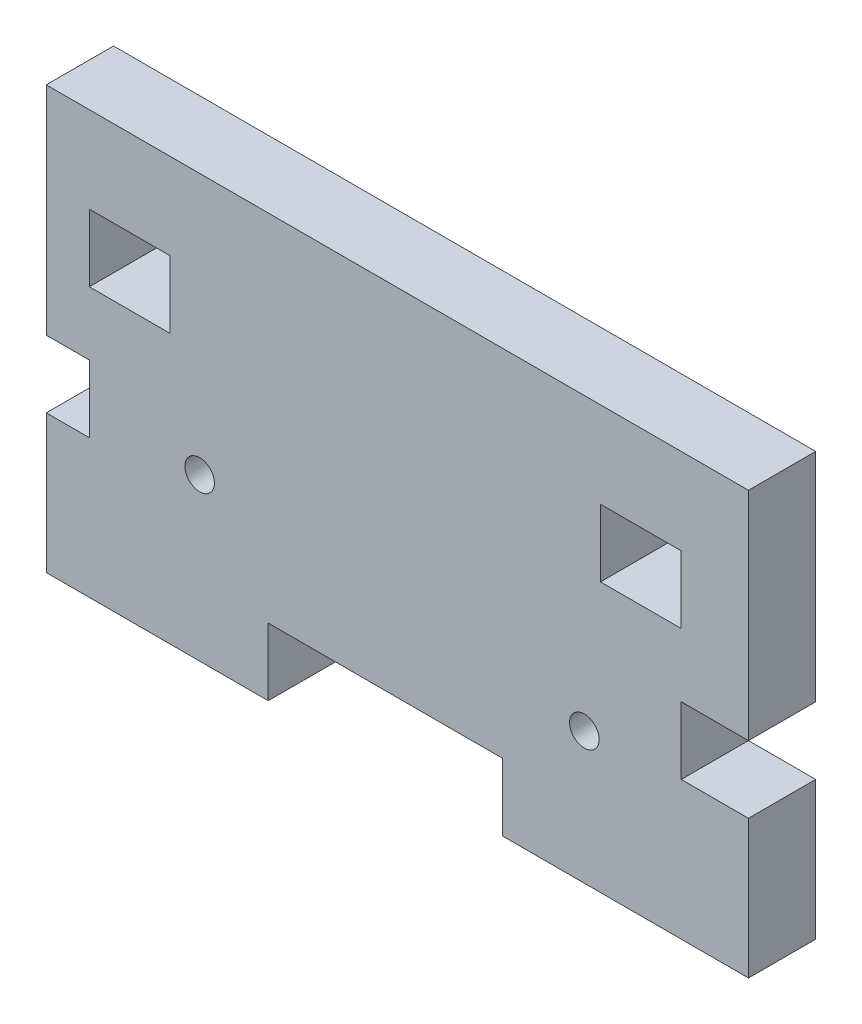
from build123d import *

# Parameters (mm, degrees)
SKETCH1_W             = 66.294
SKETCH1_H             = 39.878
BOSS_EXTRUDE1_DEPTH   = 3.175
CAVITY1_START         = -19.939
CAVITY1_OUTLINE_W     = 22.098
CAVITY1_OUTLINE_H     = 6.35
CAVITY1_DEPTH         = 6.35
CAVITY1_START_2       = 5.461
CAVITY1_2_OUTLINE_W   = 7.62
CAVITY1_2_OUTLINE_H   = 6.35
CAVITY1_2_DEPTH       = 6.35
CAVITY1_START_3       = -6.879912323
CAVITY1_3_OUTLINE_W   = 6.35
CAVITY1_3_OUTLINE_H   = 6.35
CAVITY1_3_OUTLINE_W_2 = 4.064
CAVITY1_3_DEPTH       = 6.35
SKETCH4_R             = 1.397
CUT_EXTRUDE1_DEPTH    = 40.199615177


# Read off the part's stored shape, not the designer's step: Cavity1
with BuildPart() as part:
    # Sketch1 → Boss-Extrude1 (new, symmetric)
    with BuildSketch(Plane.XY):
        Rectangle(SKETCH1_W, SKETCH1_H)
    extrude(amount=BOSS_EXTRUDE1_DEPTH, both=True)

    # Cavity1 outline → Cavity1 (cut)
    with BuildSketch(Plane(origin=(0, 0, 0), x_dir=(1, 0, 0), z_dir=(0, 1, 0)).offset(CAVITY1_START)):
        with Locations((-1.143, 0)):
            Rectangle(CAVITY1_OUTLINE_W, CAVITY1_OUTLINE_H)
    extrude(amount=CAVITY1_DEPTH, mode=Mode.SUBTRACT)

    # Cavity1 2 outline → Cavity1 2 (cut)
    with BuildSketch(Plane(origin=(0, 0, 0), x_dir=(1, 0, 0), z_dir=(0, 1, 0)).offset(CAVITY1_START_2)):
        with Locations((22.987, 0)):
            Rectangle(CAVITY1_2_OUTLINE_W, CAVITY1_2_OUTLINE_H)
        with Locations((-25.273, 0)):
            Rectangle(CAVITY1_2_OUTLINE_W, CAVITY1_2_OUTLINE_H)
    extrude(amount=CAVITY1_2_DEPTH, mode=Mode.SUBTRACT)

    # Cavity1 3 outline → Cavity1 3 (cut)
    with BuildSketch(Plane(origin=(0, 0, 0), x_dir=(1, 0, 0), z_dir=(0, 1, 0)).offset(CAVITY1_START_3)):
        with Locations((29.972, 0)):
            Rectangle(CAVITY1_3_OUTLINE_W, CAVITY1_3_OUTLINE_H)
        with Locations((-31.115, 0)):
            Rectangle(CAVITY1_3_OUTLINE_W_2, CAVITY1_3_OUTLINE_H)
    extrude(amount=CAVITY1_3_DEPTH, mode=Mode.SUBTRACT)

    # Sketch4 → Cut-Extrude1 (cut, through all)
    with BuildSketch(Plane(origin=(0, 0, -3.175), x_dir=(-1, 0, 0), z_dir=(0, 0, -1))):
        with Locations((-17.653, -7.493)):
            Circle(SKETCH4_R)
        with Locations((18.669, -4.699)):
            Circle(SKETCH4_R)
    extrude(amount=-CUT_EXTRUDE1_DEPTH, mode=Mode.SUBTRACT)


solid = part.part
